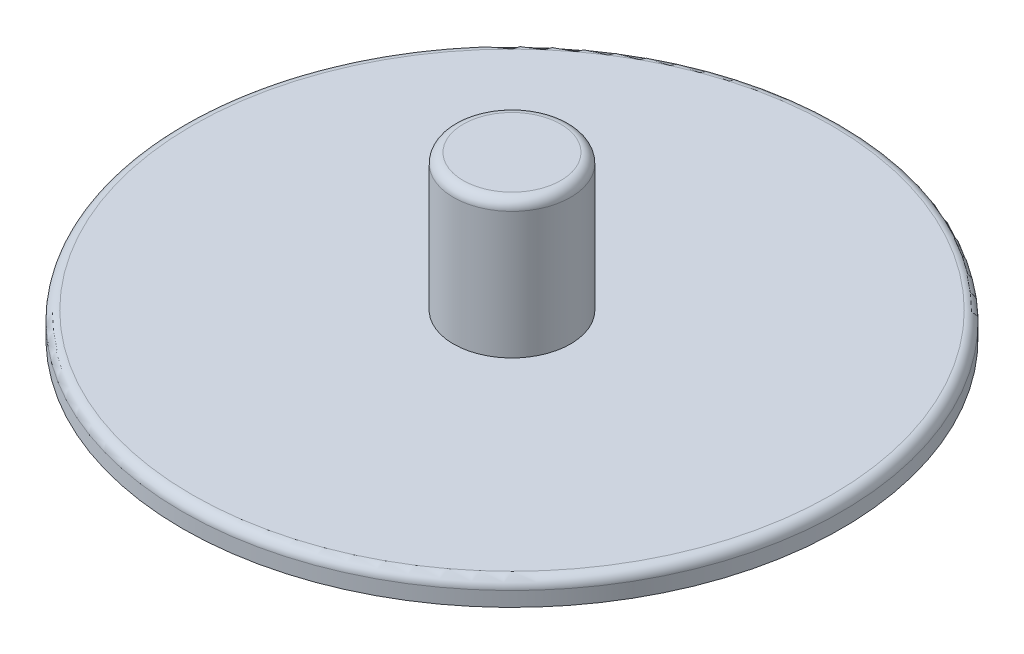
from build123d import *

# Parameters (mm, degrees)
SKETCH1_R           = 85.725
BOSS_EXTRUDE1_DEPTH = 6.35
SKETCH2_R           = 15.24
BOSS_EXTRUDE2_DEPTH = 35.56
FILLET1_R           = 2.54
FILLET2_R           = 2.54


with BuildPart() as part:
    # Sketch1 → Boss-Extrude1 (new body)
    with BuildSketch(Plane(origin=(0, 0, 0), x_dir=(1, 0, 0), z_dir=(0, 1, 0))):
        Circle(SKETCH1_R)
    extrude(amount=BOSS_EXTRUDE1_DEPTH)

    # Sketch2 → Boss-Extrude2 (add)
    with BuildSketch(Plane(origin=(0, 6.35, 0), x_dir=(1, 0, 0), z_dir=(0, 1, 0))):
        Circle(SKETCH2_R)
    extrude(amount=BOSS_EXTRUDE2_DEPTH)

    # Fillet1
    fillet1_edges = [part.edges().sort_by_distance(p)[0] for p in [
        (-15.24, 41.91, 0),
    ]]
    fillet(fillet1_edges, radius=FILLET1_R)

    # Fillet2
    fillet2_edges = [part.edges().sort_by_distance(p)[0] for p in [
        (-85.725, 6.35, 0),
    ]]
    fillet(fillet2_edges, radius=FILLET2_R)


solid = part.part
